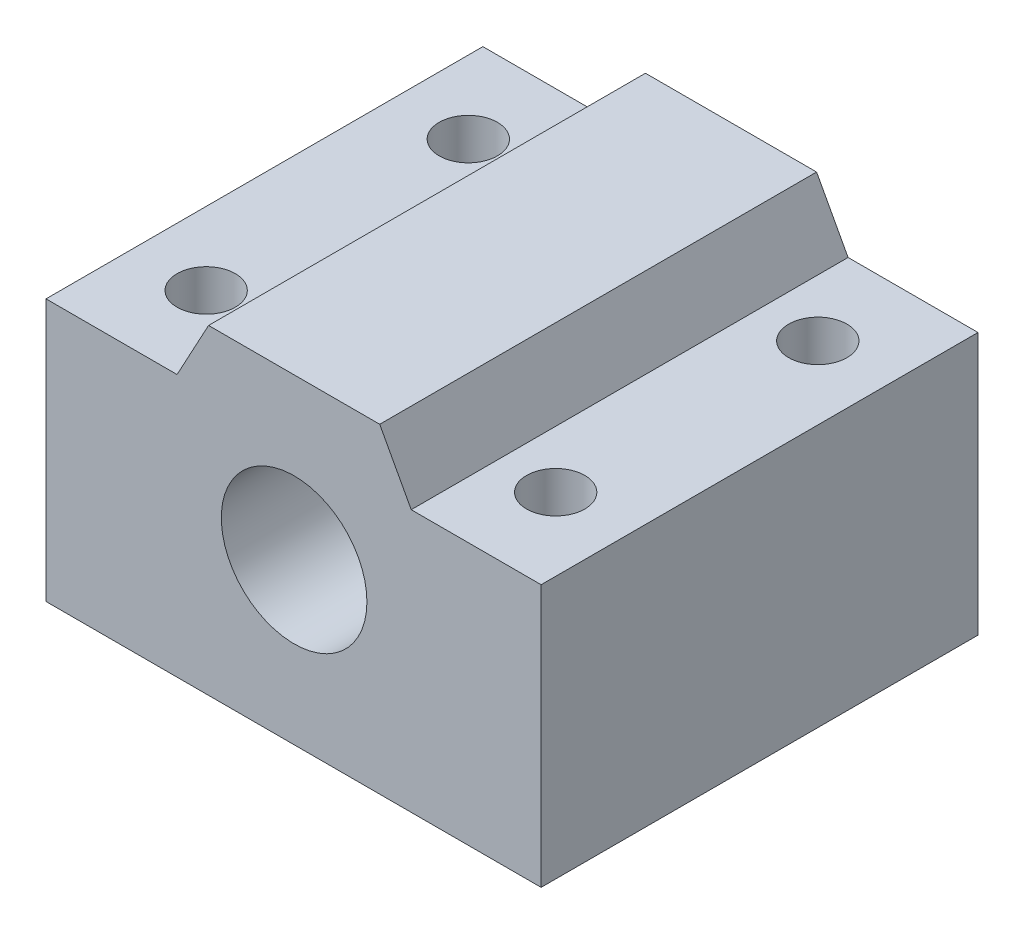
from build123d import *

# Parameters (mm, degrees)
BOSS_EXTRUDE2_DEPTH = 30
HOLE_R              = 5
CUT_EXTRUDE1_DEPTH  = 30
MOUNT_HOLE_R        = 2
CUT_EXTRUDE2_DEPTH  = 15


with BuildPart() as part:
    # body → Boss-Extrude2 (new body)
    with BuildSketch(Plane.XY):
        Polygon((-8.038514806, 7.000509517), (-5.875565247, 11.000552922), (5.877594601, 11.000552922), (8.04054416, 7.000509517), (16.961485195, 7.000509517), (16.961485195, -10.999447078), (-17.038514805, -10.999447078), (-17.038514805, 7.000509517), align=None)
    extrude(amount=-BOSS_EXTRUDE2_DEPTH)

    # hole → Cut-Extrude1 (cut)
    with BuildSketch(Plane.XY):
        Circle(HOLE_R)
    extrude(amount=-CUT_EXTRUDE1_DEPTH, mode=Mode.SUBTRACT)

    # mount hole → Cut-Extrude2 (cut, symmetric)
    with BuildSketch(Plane(origin=(0, 0, 0), x_dir=(1, 0, 0), z_dir=(0, 1, 0))):
        with Locations((-12.038514805, 6)):
            Circle(MOUNT_HOLE_R)
        with Locations((11.961485195, 6)):
            Circle(MOUNT_HOLE_R)
        with Locations((11.961485195, 24)):
            Circle(MOUNT_HOLE_R)
        with Locations((-12.038514805, 24)):
            Circle(MOUNT_HOLE_R)
    extrude(amount=CUT_EXTRUDE2_DEPTH, both=True, mode=Mode.SUBTRACT)


solid = part.part
